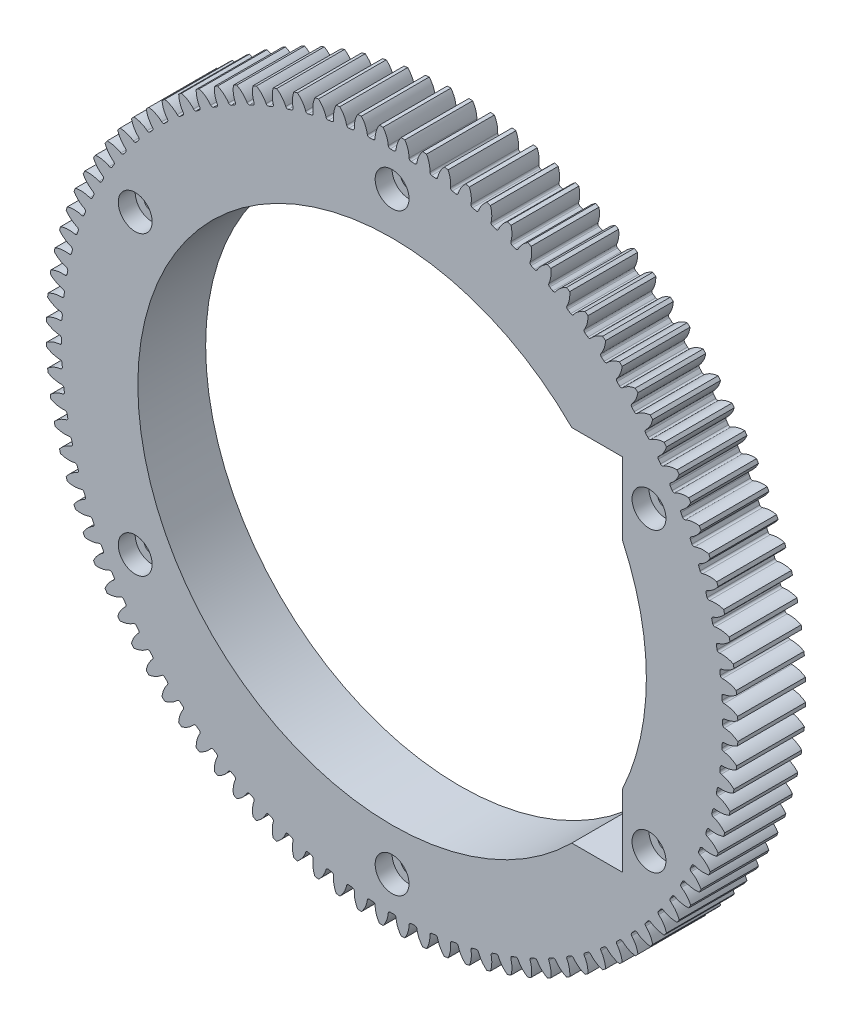
from build123d import *

# Parameters (mm, degrees)
SKETCH2_R                = 102
BOSS_EXTRUDE1_DEPTH      = 10
CUT_EXTRUDE1_DEPTH       = 145.595988879
FILLET1_R                = 0.6
CIRPATTERN1_COUNT        = 100
FILLET1_OF_CIRPATTERN1_R = 0.6
SKETCH4_R                = 5
CUT_EXTRUDE3_DEPTH       = 10
SKETCH5_R                = 75
SKETCH5_R_2              = 2.5
CUT_EXTRUDE4_DEPTH       = 146.581493296
SKETCH6_R                = 5
CUT_EXTRUDE5_DEPTH       = 5
SKETCH7_W                = 15
SKETCH7_H                = 106.131993292
CUT_EXTRUDE6_DEPTH       = 20


with BuildPart() as part:
    # Sketch2 → Boss-Extrude1 (new, symmetric)
    with BuildSketch(Plane.XY):
        Circle(SKETCH2_R)
    extrude(amount=BOSS_EXTRUDE1_DEPTH, both=True)

    # Sketch3 → Cut-Extrude1 (cut, symmetric)
    with BuildSketch(Plane.XY):
        with BuildLine():
            ThreePointArc((1.1162271, 97.493610237), (0, 97.5), (-1.1162271, 97.493610237))
            ThreePointArc((-1.1162271, 97.493610237), (-1.523059218, 99.852715048), (-2.6484764, 101.965609755))
            ThreePointArc((-2.6484764, 101.965609755), (0, 102), (2.6484764, 101.965609755))
            ThreePointArc((2.6484764, 101.965609755), (1.523059218, 99.852715048), (1.1162271, 97.493610237))
        make_face()
    cut_extrude1 = extrude(amount=CUT_EXTRUDE1_DEPTH, both=True, mode=Mode.SUBTRACT)

    # Fillet1
    fillet1_edges = [part.edges().sort_by_distance(p)[0] for p in [
        (1.1162271, 97.493610237, 0),
        (-1.1162271, 97.493610237, 0),
    ]]
    fillet(fillet1_edges, radius=FILLET1_R)

    # CirPattern1: Cut-Extrude1 ×100 about axis
    cirpattern1_axis = Axis((0, 0, -11), (0, 0, 1))
    for i in range(1, CIRPATTERN1_COUNT):
        add(cut_extrude1.rotate(cirpattern1_axis, i * 360 / CIRPATTERN1_COUNT), mode=Mode.SUBTRACT)

    # Fillet1 of CirPattern1
    fillet1_of_cirpattern1_edges = [part.edges().sort_by_distance(p)[0] for p in [
        (-5.007649956, 97.371317347, 0),
        (-7.235698919, 97.231140388, 0),
        (-11.111764107, 96.864744352, 0),
        (-13.326614739, 96.584943649, 0),
        (-17.1720252, 95.975890465, 0),
        (-19.3649365, 95.557570262, 0),
        (-23.164516156, 94.708263585, 0),
        (-25.326833703, 94.153074802, 0),
        (-29.065587349, 93.066866457, 0),
        (-31.188777464, 92.37700017, 0),
        (-34.851949947, 91.058176925, 0),
        (-36.927633369, 90.236355721, 0),
        (-40.500767822, 88.690122369, 0),
        (-42.520752776, 87.739589601, 0),
        (-45.989747669, 85.972048419, 0),
        (-47.946062198, 84.896555406, 0),
        (-51.297226992, 82.914682071, 0),
        (-53.182150416, 81.718473292, 0),
        (-56.402259596, 79.530089353, 0),
        (-58.208352984, 78.217885697, 0),
        (-61.28469825, 75.831627705, 0),
        (-63.004833775, 74.408607842, 0),
        (-65.925274197, 71.833893268, 0),
        (-67.552663272, 70.305673206, 0),
        (-70.305673206, 67.552663272, 0),
        (-71.833893268, 65.925274197, 0),
        (-74.408607842, 63.004833775, 0),
        (-75.831627705, 61.28469825, 0),
        (-78.217885697, 58.208352984, 0),
        (-79.530089353, 56.402259596, 0),
        (-81.718473292, 53.182150416, 0),
        (-82.914682071, 51.297226992, 0),
        (-84.896555406, 47.946062198, 0),
        (-85.972048419, 45.989747669, 0),
        (-87.739589601, 42.520752776, 0),
        (-88.690122369, 40.500767822, 0),
        (-90.236355721, 36.927633369, 0),
        (-91.058176925, 34.851949947, 0),
        (-92.37700017, 31.188777464, 0),
        (-93.066866457, 29.065587349, 0),
        (-94.153074802, 25.326833703, 0),
        (-94.708263585, 23.164516156, 0),
        (-95.557570262, 19.3649365, 0),
        (-95.975890465, 17.1720252, 0),
        (-96.584943649, 13.326614739, 0),
        (-96.864744352, 11.111764107, 0),
        (-97.231140388, 7.235698919, 0),
        (-97.371317347, 5.007649956, 0),
        (-97.493610237, 1.1162271, 0),
        (-97.493610237, -1.1162271, 0),
        (-97.371317347, -5.007649956, 0),
        (-97.231140388, -7.235698919, 0),
        (-96.864744352, -11.111764107, 0),
        (-96.584943649, -13.326614739, 0),
        (-95.975890465, -17.1720252, 0),
        (-95.557570262, -19.3649365, 0),
        (-94.708263585, -23.164516156, 0),
        (-94.153074802, -25.326833703, 0),
        (-93.066866457, -29.065587349, 0),
        (-92.37700017, -31.188777464, 0),
        (-91.058176925, -34.851949947, 0),
        (-90.236355721, -36.927633369, 0),
        (-88.690122369, -40.500767822, 0),
        (-87.739589601, -42.520752776, 0),
        (-85.972048419, -45.989747669, 0),
        (-84.896555406, -47.946062198, 0),
        (-82.914682071, -51.297226992, 0),
        (-81.718473292, -53.182150416, 0),
        (-79.530089353, -56.402259596, 0),
        (-78.217885697, -58.208352984, 0),
        (-75.831627705, -61.28469825, 0),
        (-74.408607842, -63.004833775, 0),
        (-71.833893268, -65.925274197, 0),
        (-70.305673206, -67.552663272, 0),
        (-67.552663272, -70.305673206, 0),
        (-65.925274197, -71.833893268, 0),
        (-63.004833775, -74.408607842, 0),
        (-61.28469825, -75.831627705, 0),
        (-58.208352984, -78.217885697, 0),
        (-56.402259596, -79.530089353, 0),
        (-53.182150416, -81.718473292, 0),
        (-51.297226992, -82.914682071, 0),
        (-47.946062198, -84.896555406, 0),
        (-45.989747669, -85.972048419, 0),
        (-42.520752776, -87.739589601, 0),
        (-40.500767822, -88.690122369, 0),
        (-36.927633369, -90.236355721, 0),
        (-34.851949947, -91.058176925, 0),
        (-31.188777464, -92.37700017, 0),
        (-29.065587349, -93.066866457, 0),
        (-25.326833703, -94.153074802, 0),
        (-23.164516156, -94.708263585, 0),
        (-19.3649365, -95.557570262, 0),
        (-17.1720252, -95.975890465, 0),
        (-13.326614739, -96.584943649, 0),
        (-11.111764107, -96.864744352, 0),
        (-7.235698919, -97.231140388, 0),
        (-5.007649956, -97.371317347, 0),
        (-1.1162271, -97.493610237, 0),
        (1.1162271, -97.493610237, 0),
        (5.007649956, -97.371317347, 0),
        (7.235698919, -97.231140388, 0),
        (11.111764107, -96.864744352, 0),
        (13.326614739, -96.584943649, 0),
        (17.1720252, -95.975890465, 0),
        (19.3649365, -95.557570262, 0),
        (23.164516156, -94.708263585, 0),
        (25.326833703, -94.153074802, 0),
        (29.065587349, -93.066866457, 0),
        (31.188777464, -92.37700017, 0),
        (34.851949947, -91.058176925, 0),
        (36.927633369, -90.236355721, 0),
        (40.500767822, -88.690122369, 0),
        (42.520752776, -87.739589601, 0),
        (45.989747669, -85.972048419, 0),
        (47.946062198, -84.896555406, 0),
        (51.297226992, -82.914682071, 0),
        (53.182150416, -81.718473292, 0),
        (56.402259596, -79.530089353, 0),
        (58.208352984, -78.217885697, 0),
        (61.28469825, -75.831627705, 0),
        (63.004833775, -74.408607842, 0),
        (65.925274197, -71.833893268, 0),
        (67.552663272, -70.305673206, 0),
        (70.305673206, -67.552663272, 0),
        (71.833893268, -65.925274197, 0),
        (74.408607842, -63.004833775, 0),
        (75.831627705, -61.28469825, 0),
        (78.217885697, -58.208352984, 0),
        (79.530089353, -56.402259596, 0),
        (81.718473292, -53.182150416, 0),
        (82.914682071, -51.297226992, 0),
        (84.896555406, -47.946062198, 0),
        (85.972048419, -45.989747669, 0),
        (87.739589601, -42.520752776, 0),
        (88.690122369, -40.500767822, 0),
        (90.236355721, -36.927633369, 0),
        (91.058176925, -34.851949947, 0),
        (92.37700017, -31.188777464, 0),
        (93.066866457, -29.065587349, 0),
        (94.153074802, -25.326833703, 0),
        (94.708263585, -23.164516156, 0),
        (95.557570262, -19.3649365, 0),
        (95.975890465, -17.1720252, 0),
        (96.584943649, -13.326614739, 0),
        (96.864744352, -11.111764107, 0),
        (97.231140388, -7.235698919, 0),
        (97.371317347, -5.007649956, 0),
        (97.493610237, -1.1162271, 0),
        (97.493610237, 1.1162271, 0),
        (97.371317347, 5.007649956, 0),
        (97.231140388, 7.235698919, 0),
        (96.864744352, 11.111764107, 0),
        (96.584943649, 13.326614739, 0),
        (95.975890465, 17.1720252, 0),
        (95.557570262, 19.3649365, 0),
        (94.708263585, 23.164516156, 0),
        (94.153074802, 25.326833703, 0),
        (93.066866457, 29.065587349, 0),
        (92.37700017, 31.188777464, 0),
        (91.058176925, 34.851949947, 0),
        (90.236355721, 36.927633369, 0),
        (88.690122369, 40.500767822, 0),
        (87.739589601, 42.520752776, 0),
        (85.972048419, 45.989747669, 0),
        (84.896555406, 47.946062198, 0),
        (82.914682071, 51.297226992, 0),
        (81.718473292, 53.182150416, 0),
        (79.530089353, 56.402259596, 0),
        (78.217885697, 58.208352984, 0),
        (75.831627705, 61.28469825, 0),
        (74.408607842, 63.004833775, 0),
        (71.833893268, 65.925274197, 0),
        (70.305673206, 67.552663272, 0),
        (67.552663272, 70.305673206, 0),
        (65.925274197, 71.833893268, 0),
        (63.004833775, 74.408607842, 0),
        (61.28469825, 75.831627705, 0),
        (58.208352984, 78.217885697, 0),
        (56.402259596, 79.530089353, 0),
        (53.182150416, 81.718473292, 0),
        (51.297226992, 82.914682071, 0),
        (47.946062198, 84.896555406, 0),
        (45.989747669, 85.972048419, 0),
        (42.520752776, 87.739589601, 0),
        (40.500767822, 88.690122369, 0),
        (36.927633369, 90.236355721, 0),
        (34.851949947, 91.058176925, 0),
        (31.188777464, 92.37700017, 0),
        (29.065587349, 93.066866457, 0),
        (25.326833703, 94.153074802, 0),
        (23.164516156, 94.708263585, 0),
        (19.3649365, 95.557570262, 0),
        (17.1720252, 95.975890465, 0),
        (13.326614739, 96.584943649, 0),
        (11.111764107, 96.864744352, 0),
        (7.235698919, 97.231140388, 0),
        (5.007649956, 97.371317347, 0),
    ]]
    fillet(fillet1_of_cirpattern1_edges, radius=FILLET1_OF_CIRPATTERN1_R)

    # Sketch4 → Cut-Extrude3 (cut)
    with BuildSketch(Plane(origin=(0, 0, -10), x_dir=(-1, 0, 0), z_dir=(0, 0, -1))):
        Circle(SKETCH4_R)
    extrude(amount=-CUT_EXTRUDE3_DEPTH, mode=Mode.SUBTRACT)

    # Sketch5 → Cut-Extrude4 (cut, through all)
    with BuildSketch(Plane.XY.offset(10)):
        Circle(SKETCH5_R)
        with Locations((0, 87.5)):
            Circle(SKETCH5_R_2)
        with Locations((75.777222831, 43.75)):
            Circle(SKETCH5_R_2)
        with Locations((75.777222831, -43.75)):
            Circle(SKETCH5_R_2)
        with Locations((0, -87.5)):
            Circle(SKETCH5_R_2)
        with Locations((-75.777222831, -43.75)):
            Circle(SKETCH5_R_2)
        with Locations((-75.777222831, 43.75)):
            Circle(SKETCH5_R_2)
    extrude(amount=-CUT_EXTRUDE4_DEPTH, mode=Mode.SUBTRACT)

    # Sketch6 → Cut-Extrude5 (cut)
    with BuildSketch(Plane.XY.offset(10)):
        with Locations((0, 87.5)):
            Circle(SKETCH6_R)
        with Locations((75.777222831, 43.75)):
            Circle(SKETCH6_R)
        with Locations((75.777222831, -43.75)):
            Circle(SKETCH6_R)
        with Locations((0, -87.5)):
            Circle(SKETCH6_R)
        with Locations((-75.777222831, -43.75)):
            Circle(SKETCH6_R)
        with Locations((-75.777222831, 43.75)):
            Circle(SKETCH6_R)
    extrude(amount=-CUT_EXTRUDE5_DEPTH, mode=Mode.SUBTRACT)

    # Sketch7 → Cut-Extrude6 (cut)
    with BuildSketch(Plane.XY.offset(10)):
        with Locations((60.5, 0)):
            Rectangle(SKETCH7_W, SKETCH7_H)
    extrude(amount=-CUT_EXTRUDE6_DEPTH, mode=Mode.SUBTRACT)


solid = part.part
